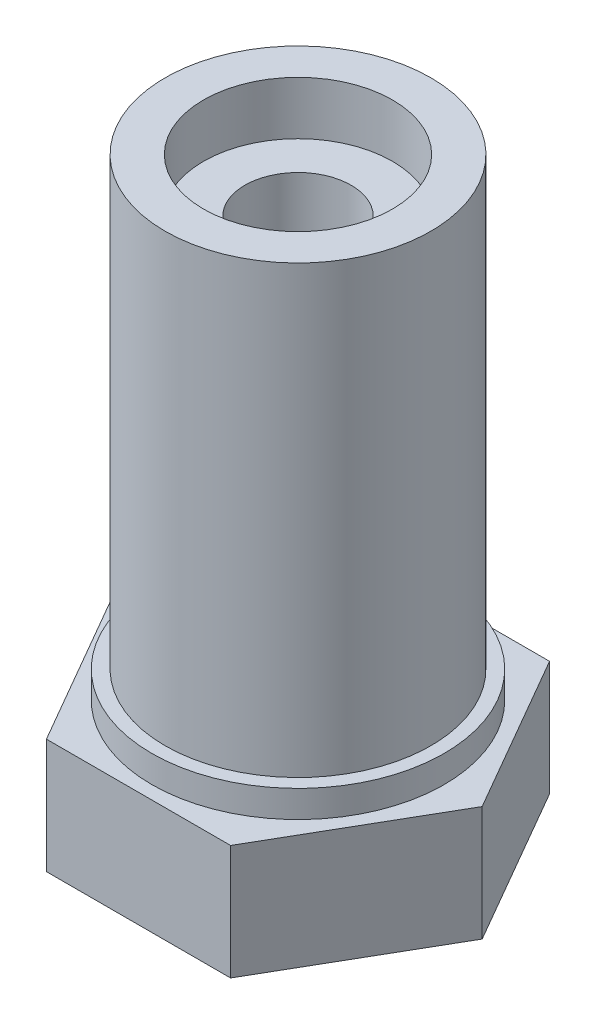
from build123d import *

# Parameters (mm, degrees)
BOSS_EXTRUDE1_DEPTH = 4.318
SKETCH2_R           = 5.500000049
SKETCH2_R_2         = 5.000000033
BOSS_EXTRUDE2_DEPTH = 1.016
SKETCH2_2_R         = 5.000000033
BOSS_EXTRUDE3_DEPTH = 17.78
SKETCH4_R           = 2.000000064
CUT_EXTRUDE2_DEPTH  = 24.923244011
SKETCH4_3_R         = 3.556
SKETCH4_3_R_2       = 2.000000064
CUT_EXTRUDE3_DEPTH  = 2


with BuildPart() as part:
    # Sketch1 → Boss-Extrude1 (new body)
    with BuildSketch(Plane(origin=(0, 0, 0), x_dir=(1, 0, 0), z_dir=(0, 1, 0))):
        Polygon((3.464101615, 6), (-3.464101615, 6), (-6.92820323, 0), (-3.464101615, -6), (3.464101615, -6), (6.92820323, 0), align=None)
    extrude(amount=BOSS_EXTRUDE1_DEPTH)

    # Sketch2 → Boss-Extrude2 (add)
    with BuildSketch(Plane(origin=(0, 4.318, 0), x_dir=(1, 0, 0), z_dir=(0, 1, 0))):
        Circle(SKETCH2_R)
        Circle(SKETCH2_R_2, mode=Mode.SUBTRACT)
    extrude(amount=BOSS_EXTRUDE2_DEPTH)

    # Sketch2<2> → Boss-Extrude3 (add)
    with BuildSketch(Plane(origin=(0, 4.318, 0), x_dir=(1, 0, 0), z_dir=(0, 1, 0))):
        Circle(SKETCH2_2_R)
    extrude(amount=BOSS_EXTRUDE3_DEPTH)

    # Sketch4 → Cut-Extrude2 (cut, through all)
    with BuildSketch(Plane(origin=(0, 22.098, 0), x_dir=(1, 0, 0), z_dir=(0, 1, 0))):
        Circle(SKETCH4_R)
    extrude(amount=-CUT_EXTRUDE2_DEPTH, mode=Mode.SUBTRACT)

    # Sketch4<3> → Cut-Extrude3 (cut)
    with BuildSketch(Plane(origin=(0, 22.098, 0), x_dir=(1, 0, 0), z_dir=(0, 1, 0))):
        Circle(SKETCH4_3_R)
        Circle(SKETCH4_3_R_2, mode=Mode.SUBTRACT)
    extrude(amount=-CUT_EXTRUDE3_DEPTH, mode=Mode.SUBTRACT)


solid = part.part
